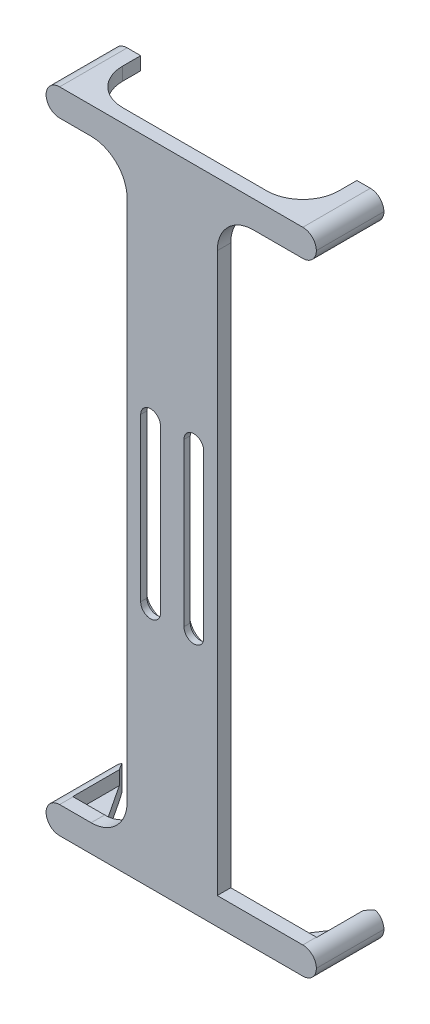
from build123d import *

# Parameters (mm, degrees)
BOSS_EXTRUDE1_DEPTH = 7.5
BOSS_EXTRUDE2_DEPTH = 30
FILLET1_R           = 20
FILLET2_R           = 20
FILLET4_R           = 7.5
CUT_EXTRUDE1_DEPTH  = 363.336169875
CUT_EXTRUDE2_DEPTH  = 4
CHAMFER1_START      = -352.5
CHAMFER1_DEPTH      = 15.5
CHAMFER1_2_DEPTH    = 7.3


with BuildPart() as part:
    # Sketch1 → Boss-Extrude1 (new body)
    with BuildSketch(Plane.XY):
        Polygon((-75, -337.5), (-30, -337.5), (-30, -7.5), (-75, -7.5), (-75, 7.5), (75, 7.5), (75, -7.5), (20, -7.5), (20, -337.5), (75, -337.5), (75, -352.5), (-75, -352.5), align=None)
    extrude(amount=BOSS_EXTRUDE1_DEPTH)

    # Sketch2 → Boss-Extrude2 (add)
    with BuildSketch(Plane(origin=(0, 0, 0), x_dir=(-1, 0, 0), z_dir=(0, 0, -1))):
        Polygon((67.7, -337.5), (67.7, -345.2), (60, -345.2), (60, -352.5), (75, -352.5), (75, -337.5), align=None)
        Polygon((-67.7, -337.5), (-67.7, -345.2), (-60, -345.2), (-60, -352.5), (-75, -352.5), (-75, -337.5), align=None)
        Polygon((-67.7, -7.5), (-75, -7.5), (-75, 7.5), (-60, 7.5), (-60, 0), (-67.7, 0), align=None)
        Polygon((67.7, -7.5), (75, -7.5), (75, 7.5), (60, 7.5), (60, 0.2), (67.7, 0.2), align=None)
    extrude(amount=BOSS_EXTRUDE2_DEPTH)

    # Fillet1
    fillet1_edges = [part.edges().sort_by_distance(p)[0] for p in [
        (-60, -348.85, 0),
        (60, -348.85, 0),
        (60, 3.75, 0),
        (-60, 3.85, 0),
    ]]
    fillet(fillet1_edges, radius=FILLET1_R)

    # Fillet2
    fillet2_edges = [part.edges().sort_by_distance(p)[0] for p in [
        (20, -7.5, 3.75),
        (-30, -337.5, 3.75),
        (-30, -7.5, 3.75),
    ]]
    fillet(fillet2_edges, radius=FILLET2_R)

    # Fillet4
    fillet4_edges = [part.edges().sort_by_distance(p)[0] for p in [
        (-75, -352.5, -11.25),
        (-75, -337.5, -11.25),
        (-75, -7.5, -11.25),
        (-75, 7.5, -11.25),
        (75, 7.5, -11.25),
        (75, -7.5, -11.25),
        (75, -337.5, -11.25),
        (75, -352.5, -11.25),
    ]]
    fillet(fillet4_edges, radius=FILLET4_R - 0.0001)  # a hair under: the kernel refuses the full size

    # Sketch3 → Cut-Extrude1 (cut, through all)
    with BuildSketch(Plane.XY.offset(7.5)):
        with BuildLine():
            Line((-22.5, -217.5), (-22.5, -127.5))
            ThreePointArc((-22.5, -127.5), (-17, -122), (-11.5, -127.5))
            Line((-11.5, -127.5), (-11.5, -217.5))
            ThreePointArc((-11.5, -217.5), (-17, -223), (-22.5, -217.5))
        make_face()
        with BuildLine():
            Line((1.5, -217.5), (1.5, -127.5))
            ThreePointArc((1.5, -127.5), (7, -122), (12.5, -127.5))
            Line((12.5, -127.5), (12.5, -217.5))
            ThreePointArc((12.5, -217.5), (7, -223), (1.5, -217.5))
        make_face()
    extrude(amount=-CUT_EXTRUDE1_DEPTH, mode=Mode.SUBTRACT)

    # Sketch4 → Cut-Extrude2 (cut)
    with BuildSketch(Plane(origin=(0, 0, 0), x_dir=(-1, 0, 0), z_dir=(0, 0, -1))):
        with BuildLine():
            Line((27, -127.5), (27, -217.5))
            ThreePointArc((27, -217.5), (17, -227.5), (7, -217.5))
            Line((7, -217.5), (7, -127.5))
            ThreePointArc((7, -127.5), (17, -117.5), (27, -127.5))
        make_face()
        with BuildLine():
            Line((3, -127.5), (3, -217.5))
            ThreePointArc((3, -217.5), (-7, -227.5), (-17, -217.5))
            Line((-17, -217.5), (-17, -127.5))
            ThreePointArc((-17, -127.5), (-7, -117.5), (3, -127.5))
        make_face()
    extrude(amount=-CUT_EXTRUDE2_DEPTH, mode=Mode.SUBTRACT)

    # Chamfer1: read off the stored shape, not the designer's step
    # Chamfer1 outline → Chamfer1 (cut)
    with BuildSketch(Plane(origin=(0, 0, 0), x_dir=(1, 0, 0), z_dir=(0, 1, 0)).offset(CHAMFER1_START)):
        with BuildLine():
            Line((70.453642879, 30), (60, 30))
            Line((60, 30), (60, 20))
            ThreePointArc((60, 20), (59.425347085, 15.240179557), (57.734410936, 10.753883584))
            Line((57.734410936, 10.753883584), (70.453642879, 30))
        make_face()
        with BuildLine():
            ThreePointArc((-57.734410936, 10.753883584), (-59.425347085, 15.240179557), (-60, 20))
            Line((-60, 20), (-60, 30))
            Line((-60, 30), (-70.453642879, 30))
            Line((-70.453642879, 30), (-57.734410936, 10.753883584))
        make_face()
    extrude(amount=CHAMFER1_DEPTH, mode=Mode.SUBTRACT)

    # Chamfer1 2 outline → Chamfer1 2 (add)
    with BuildSketch(Plane(origin=(0, 0, 0), x_dir=(1, 0, 0), z_dir=(0, 1, 0)).offset(CHAMFER1_START)):
        with BuildLine():
            ThreePointArc((55.458381501, 7.309907748), (56.685490998, 8.973015363), (57.734410936, 10.753883584))
            Line((57.734410936, 10.753883584), (55.458381501, 7.309907748))
        make_face()
        with BuildLine():
            ThreePointArc((-57.734410936, 10.753883584), (-56.685490998, 8.973015363), (-55.458381501, 7.309907748))
            Line((-55.458381501, 7.309907748), (-57.734410936, 10.753883584))
        make_face()
    extrude(amount=CHAMFER1_2_DEPTH)


solid = part.part
